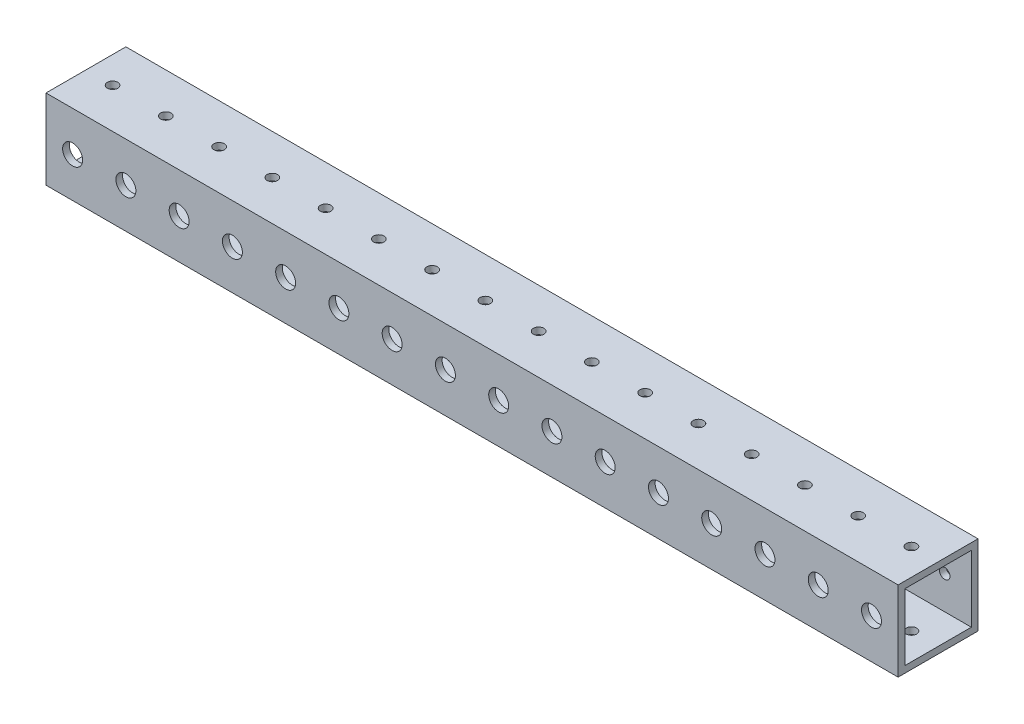
from build123d import *

# Parameters (mm, degrees)
SKETCH1_W                        = 38.1
SKETCH1_H                        = 38.1
SKETCH1_W_2                      = 31.75
SKETCH1_H_2                      = 31.75
BOSS_EXTRUDE1_DEPTH              = 203.2
SKETCH3_W                        = 2.4892
SKETCH3_H                        = 3.175
SKETCH3_AT_POINT_2_W             = 2.4892
SKETCH3_AT_POINT_2_H             = 3.175
SKETCH3_AT_POINT_3_W             = 2.4892
SKETCH3_AT_POINT_3_H             = 3.175
F_3_8_0_375_DIAMETER_HOLE1_D     = 9.525
F_3_8_0_375_DIAMETER_HOLE1_DEPTH = 3.175
LPATTERN1_START                  = 15.875
LPATTERN1_OUTLINE_R              = 4.7625
LPATTERN1_DEPTH                  = 3.175
LPATTERN1_START_2                = -19.05
LPATTERN1_2_OUTLINE_R            = 2.4892
LPATTERN1_2_DEPTH                = 3.175
LPATTERN1_3_OUTLINE_R            = 2.4892
LPATTERN1_3_DEPTH                = 38.1


# Read off the part's stored shape, not the designer's step: LPattern1
with BuildPart() as part:
    # Sketch1 → Boss-Extrude1 (new, symmetric)
    with BuildSketch(Plane(origin=(0, 0, 0), x_dir=(0, 0, -1), z_dir=(1, 0, 0))):
        Rectangle(SKETCH1_W, SKETCH1_H)
        Rectangle(SKETCH1_W_2, SKETCH1_H_2, mode=Mode.SUBTRACT)
    extrude(amount=BOSS_EXTRUDE1_DEPTH, both=True)

    # Sketch3 → #9 (0.196) Diameter Hole1 (revolve, cut)
    with BuildSketch(Plane(origin=(190.5, 19.05, 0), x_dir=(0, 0, 1), z_dir=(1, 0, 0))):
        with Locations((1.2446, 1.5875)):
            Rectangle(SKETCH3_W, SKETCH3_H)
    revolve(axis=Axis((190.5, 25.4, 0), (0, -1, 0)), mode=Mode.SUBTRACT)

    # Sketch3 at point 2 (carried to point 2, square into its face) → #9 (0.196) Diameter Hole1 at 2 (revolve, cut)
    with BuildSketch(Plane(origin=(190.5, -19.05, 0), x_dir=(0, 0, 1), z_dir=(-1, 0, 0))):
        with Locations((1.2446, 1.5875)):
            Rectangle(SKETCH3_AT_POINT_2_W, SKETCH3_AT_POINT_2_H)
    revolve(axis=Axis((190.5, -25.4, 0), (0, 1, 0)), mode=Mode.SUBTRACT)

    # Sketch3 at point 3 (carried to point 3, square into its face) → #9 (0.196) Diameter Hole1 at 3 (revolve, cut)
    with BuildSketch(Plane(origin=(190.5, 0, -19.05), x_dir=(0, 1, 0), z_dir=(1, 0, 0))):
        with Locations((1.2446, 1.5875)):
            Rectangle(SKETCH3_AT_POINT_3_W, SKETCH3_AT_POINT_3_H)
    revolve(axis=Axis((190.5, 0, -25.4), (0, 0, 1)), mode=Mode.SUBTRACT)

    # 3/8 (0.375) Diameter Hole1
    with Locations(Plane(origin=(190.5, 0, 19.05), x_dir=(1, 0, 0), z_dir=(0, 0, 1))):
        with Locations((0, 0)):
            Hole(F_3_8_0_375_DIAMETER_HOLE1_D / 2, depth=F_3_8_0_375_DIAMETER_HOLE1_DEPTH)

    # LPattern1 outline → LPattern1 (cut)
    with BuildSketch(Plane.XY.offset(LPATTERN1_START)):
        with Locations((165.1, 0)):
            Circle(LPATTERN1_OUTLINE_R)
        with Locations((139.7, 0)):
            Circle(LPATTERN1_OUTLINE_R)
        with Locations((114.3, 0)):
            Circle(LPATTERN1_OUTLINE_R)
        with Locations((88.9, 0)):
            Circle(LPATTERN1_OUTLINE_R)
        with Locations((63.5, 0)):
            Circle(LPATTERN1_OUTLINE_R)
        with Locations((38.1, 0)):
            Circle(LPATTERN1_OUTLINE_R)
        with Locations((12.7, 0)):
            Circle(LPATTERN1_OUTLINE_R)
        with Locations((-12.7, 0)):
            Circle(LPATTERN1_OUTLINE_R)
        with Locations((-38.1, 0)):
            Circle(LPATTERN1_OUTLINE_R)
        with Locations((-63.5, 0)):
            Circle(LPATTERN1_OUTLINE_R)
        with Locations((-88.9, 0)):
            Circle(LPATTERN1_OUTLINE_R)
        with Locations((-114.3, 0)):
            Circle(LPATTERN1_OUTLINE_R)
        with Locations((-139.7, 0)):
            Circle(LPATTERN1_OUTLINE_R)
        with Locations((-165.1, 0)):
            Circle(LPATTERN1_OUTLINE_R)
        with Locations((-190.5, 0)):
            Circle(LPATTERN1_OUTLINE_R)
    extrude(amount=LPATTERN1_DEPTH, mode=Mode.SUBTRACT)

    # LPattern1 2 outline → LPattern1 2 (cut)
    with BuildSketch(Plane.XY.offset(LPATTERN1_START_2)):
        with Locations((165.1, 0)):
            Circle(LPATTERN1_2_OUTLINE_R)
        with Locations((139.7, 0)):
            Circle(LPATTERN1_2_OUTLINE_R)
        with Locations((114.3, 0)):
            Circle(LPATTERN1_2_OUTLINE_R)
        with Locations((88.9, 0)):
            Circle(LPATTERN1_2_OUTLINE_R)
        with Locations((63.5, 0)):
            Circle(LPATTERN1_2_OUTLINE_R)
        with Locations((38.1, 0)):
            Circle(LPATTERN1_2_OUTLINE_R)
        with Locations((12.7, 0)):
            Circle(LPATTERN1_2_OUTLINE_R)
        with Locations((-12.7, 0)):
            Circle(LPATTERN1_2_OUTLINE_R)
        with Locations((-38.1, 0)):
            Circle(LPATTERN1_2_OUTLINE_R)
        with Locations((-63.5, 0)):
            Circle(LPATTERN1_2_OUTLINE_R)
        with Locations((-88.9, 0)):
            Circle(LPATTERN1_2_OUTLINE_R)
        with Locations((-114.3, 0)):
            Circle(LPATTERN1_2_OUTLINE_R)
        with Locations((-139.7, 0)):
            Circle(LPATTERN1_2_OUTLINE_R)
        with Locations((-165.1, 0)):
            Circle(LPATTERN1_2_OUTLINE_R)
        with Locations((-190.5, 0)):
            Circle(LPATTERN1_2_OUTLINE_R)
    extrude(amount=LPATTERN1_2_DEPTH, mode=Mode.SUBTRACT)

    # LPattern1 3 outline → LPattern1 3 (cut)
    with BuildSketch(Plane(origin=(0, 0, 0), x_dir=(1, 0, 0), z_dir=(0, 1, 0)).offset(LPATTERN1_START_2)):
        with Locations((165.1, 0)):
            Circle(LPATTERN1_3_OUTLINE_R)
        with Locations((139.7, 0)):
            Circle(LPATTERN1_3_OUTLINE_R)
        with Locations((114.3, 0)):
            Circle(LPATTERN1_3_OUTLINE_R)
        with Locations((88.9, 0)):
            Circle(LPATTERN1_3_OUTLINE_R)
        with Locations((63.5, 0)):
            Circle(LPATTERN1_3_OUTLINE_R)
        with Locations((38.1, 0)):
            Circle(LPATTERN1_3_OUTLINE_R)
        with Locations((12.7, 0)):
            Circle(LPATTERN1_3_OUTLINE_R)
        with Locations((-12.7, 0)):
            Circle(LPATTERN1_3_OUTLINE_R)
        with Locations((-38.1, 0)):
            Circle(LPATTERN1_3_OUTLINE_R)
        with Locations((-63.5, 0)):
            Circle(LPATTERN1_3_OUTLINE_R)
        with Locations((-88.9, 0)):
            Circle(LPATTERN1_3_OUTLINE_R)
        with Locations((-114.3, 0)):
            Circle(LPATTERN1_3_OUTLINE_R)
        with Locations((-139.7, 0)):
            Circle(LPATTERN1_3_OUTLINE_R)
        with Locations((-165.1, 0)):
            Circle(LPATTERN1_3_OUTLINE_R)
        with Locations((-190.5, 0)):
            Circle(LPATTERN1_3_OUTLINE_R)
    extrude(amount=LPATTERN1_3_DEPTH, mode=Mode.SUBTRACT)


solid = part.part
